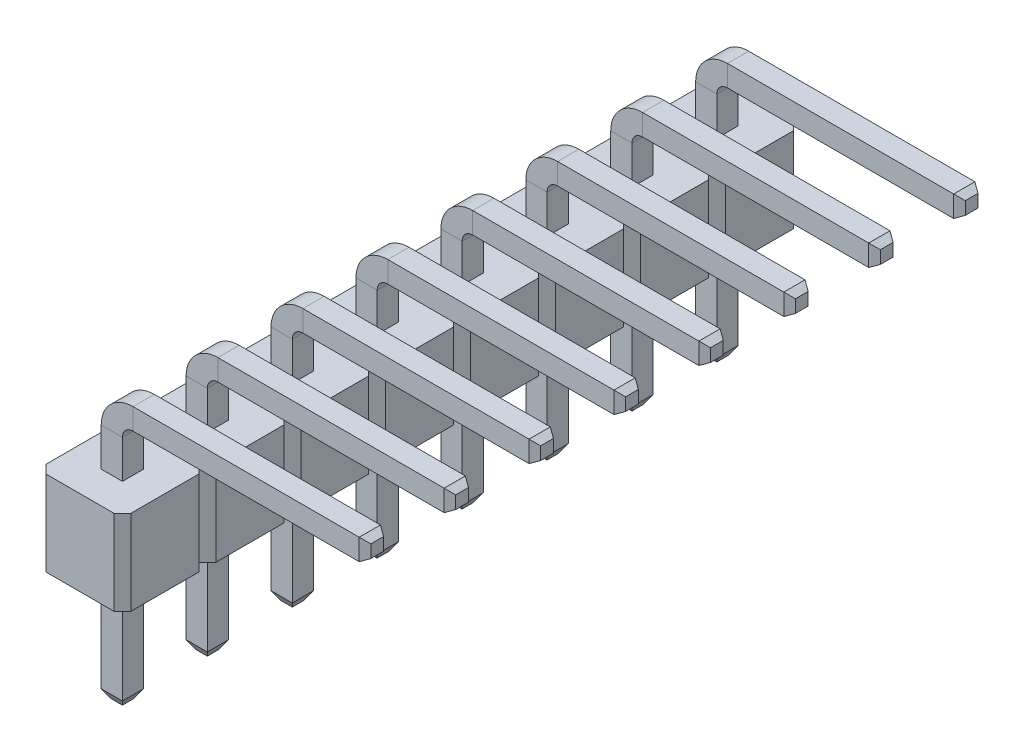
from build123d import *
from OCP.BRepFilletAPI import BRepFilletAPI_MakeChamfer

# Parameters (mm, degrees)
BOSS_EXTRUDE1_DEPTH          = 2.54
SKETCH3_W                    = 0.635
SKETCH3_H                    = 0.635
CHAMFER1_SIZE                = 0.254
CHAMFER1_SIZE2               = 0.146646968
CHAMFER2_SIZE                = 0.219970453
CHAMFER2_SIZE_2              = 0.127
LPATTERN1_COUNT              = 8
LPATTERN1_PITCH              = 2.54
CHAMFER1_OF_LPATTERN1_SIZE   = 0.254
CHAMFER1_OF_LPATTERN1_SIZE2  = 0.146646968
CHAMFER2_OF_LPATTERN1_SIZE   = 0.219970453
CHAMFER2_OF_LPATTERN1_SIZE_2 = 0.127


with BuildPart() as part:
    # Sketch1 → Boss-Extrude1 (new body)
    with BuildSketch(Plane(origin=(0, 0, 0), x_dir=(1, 0, 0), z_dir=(0, 1, 0))):
        Polygon((1.016, 1.27), (1.27, 1.016), (1.27, -1.016), (1.016, -1.27), (-1.016, -1.27), (-1.27, -1.016), (-1.27, 1.016), (-1.016, 1.27), align=None)
    boss_extrude1 = extrude(amount=BOSS_EXTRUDE1_DEPTH)

    # Sweep1: sweep along a path in Sketch2
    with BuildLine(Plane.XY) as sweep1_path:
        Line((0, -3.4036), (0, 0))
        Line((0, 0), (0, 3.683))
        ThreePointArc((0, 3.683), (0.185987194, 4.132012806), (0.635, 4.318))
        Line((0.635, 4.318), (7.62, 4.318))
    # Sketch3 → Sweep1 (sweep)
    with BuildSketch(Plane(origin=(0, -3.4036, 0), x_dir=(-1, 0, 0), z_dir=(0, -1, 0))):
        Rectangle(SKETCH3_W, SKETCH3_H)
    sweep1 = sweep(path=sweep1_path.line)

    # Chamfer1: one chamfer whose edges measure the first distance from different faces: ONE call of the kernel's chamfer builder (chamfer() names one face for all edges)
    chamfer1_edges_1 = [part.edges().sort_by_distance(p)[0] for p in [
        (0.3175, -3.4036, 0),
    ]]
    chamfer1_side_1 = [part.faces().sort_by_distance(p)[0] for p in [
        (0.3175, -1.7018, 0),
    ]]
    chamfer1_edges_2 = [part.edges().sort_by_distance(p)[0] for p in [
        (0, -3.4036, 0.3175),
    ]]
    chamfer1_side_2 = [part.faces().sort_by_distance(p)[0] for p in [
        (0, -1.7018, 0.3175),
    ]]
    chamfer1_edges_3 = [part.edges().sort_by_distance(p)[0] for p in [
        (-0.3175, -3.4036, 0),
    ]]
    chamfer1_side_3 = [part.faces().sort_by_distance(p)[0] for p in [
        (-0.3175, -1.7018, 0),
    ]]
    chamfer1_edges_4 = [part.edges().sort_by_distance(p)[0] for p in [
        (0, -3.4036, -0.3175),
    ]]
    chamfer1_side_4 = [part.faces().sort_by_distance(p)[0] for p in [
        (0, -1.7018, -0.3175),
    ]]
    chamfer1 = BRepFilletAPI_MakeChamfer(part.part.solid().wrapped)
    for e in chamfer1_edges_1:
        chamfer1.Add(CHAMFER1_SIZE, CHAMFER1_SIZE2, e.wrapped, chamfer1_side_1[0].wrapped)  # the first distance lies on this face
    for e in chamfer1_edges_2:
        chamfer1.Add(CHAMFER1_SIZE, CHAMFER1_SIZE2, e.wrapped, chamfer1_side_2[0].wrapped)  # the first distance lies on this face
    for e in chamfer1_edges_3:
        chamfer1.Add(CHAMFER1_SIZE, CHAMFER1_SIZE2, e.wrapped, chamfer1_side_3[0].wrapped)  # the first distance lies on this face
    for e in chamfer1_edges_4:
        chamfer1.Add(CHAMFER1_SIZE, CHAMFER1_SIZE2, e.wrapped, chamfer1_side_4[0].wrapped)  # the first distance lies on this face
    add(Compound.cast(chamfer1.Shape()), mode=Mode.REPLACE)

    # Chamfer2
    chamfer2_edges_1 = [part.edges().sort_by_distance(p)[0] for p in [
        (7.62, 4.0005, 0),
    ]]
    chamfer2_side_1 = [part.faces().sort_by_distance(p)[0] for p in [
        (7.61746, 4.0005, 0),
    ]]
    chamfer2_edges_2 = [part.edges().sort_by_distance(p)[0] for p in [
        (7.62, 4.318, 0.3175),
    ]]
    chamfer2_side_2 = [part.faces().sort_by_distance(p)[0] for p in [
        (7.61746, 4.318, 0.3175),
    ]]
    chamfer2_edges_3 = [part.edges().sort_by_distance(p)[0] for p in [
        (7.62, 4.6355, 0),
    ]]
    chamfer2_side_3 = [part.faces().sort_by_distance(p)[0] for p in [
        (7.62, 4.63296, 0),
    ]]
    chamfer2_edges_4 = [part.edges().sort_by_distance(p)[0] for p in [
        (7.62, 4.318, -0.3175),
    ]]
    chamfer2_side_4 = [part.faces().sort_by_distance(p)[0] for p in [
        (7.61746, 4.318, -0.3175),
    ]]
    chamfer2 = BRepFilletAPI_MakeChamfer(part.part.solid().wrapped)
    for e in chamfer2_edges_1:
        chamfer2.Add(CHAMFER2_SIZE - 0.0001, CHAMFER2_SIZE_2 - 0.0001, e.wrapped, chamfer2_side_1[0].wrapped)
    for e in chamfer2_edges_2:
        chamfer2.Add(CHAMFER2_SIZE - 0.0001, CHAMFER2_SIZE_2 - 0.0001, e.wrapped, chamfer2_side_2[0].wrapped)
    for e in chamfer2_edges_3:
        chamfer2.Add(CHAMFER2_SIZE_2 - 0.0001, CHAMFER2_SIZE - 0.0001, e.wrapped, chamfer2_side_3[0].wrapped)
    for e in chamfer2_edges_4:
        chamfer2.Add(CHAMFER2_SIZE - 0.0001, CHAMFER2_SIZE_2 - 0.0001, e.wrapped, chamfer2_side_4[0].wrapped)
    add(Compound.cast(chamfer2.Shape()), mode=Mode.REPLACE)  # a hair under: the kernel refuses the full size

    # LPattern1: Boss-Extrude1, Sweep1 ×8
    with Locations(*[(0, 0, i * LPATTERN1_PITCH) for i in range(1, LPATTERN1_COUNT)]):
        add(boss_extrude1)
        add(sweep1)

    # Chamfer1 of LPattern1: one chamfer whose edges measure the first distance from different faces: ONE call of the kernel's chamfer builder (chamfer() names one face for all edges)
    chamfer1_of_lpattern1_edges_1 = [part.edges().sort_by_distance(p)[0] for p in [
        (0.3175, -3.4036, 2.54),
    ]]
    chamfer1_of_lpattern1_side_1 = [part.faces().sort_by_distance(p)[0] for p in [
        (0.3175, -1.7018, 2.54),
    ]]
    chamfer1_of_lpattern1_edges_2 = [part.edges().sort_by_distance(p)[0] for p in [
        (0, -3.4036, 2.8575),
    ]]
    chamfer1_of_lpattern1_side_2 = [part.faces().sort_by_distance(p)[0] for p in [
        (0, -1.7018, 2.8575),
    ]]
    chamfer1_of_lpattern1_edges_3 = [part.edges().sort_by_distance(p)[0] for p in [
        (-0.3175, -3.4036, 2.54),
    ]]
    chamfer1_of_lpattern1_side_3 = [part.faces().sort_by_distance(p)[0] for p in [
        (-0.3175, -1.7018, 2.54),
    ]]
    chamfer1_of_lpattern1_edges_4 = [part.edges().sort_by_distance(p)[0] for p in [
        (0, -3.4036, 2.2225),
    ]]
    chamfer1_of_lpattern1_side_4 = [part.faces().sort_by_distance(p)[0] for p in [
        (0, -1.7018, 2.2225),
    ]]
    chamfer1_of_lpattern1_edges_5 = [part.edges().sort_by_distance(p)[0] for p in [
        (0.3175, -3.4036, 5.08),
    ]]
    chamfer1_of_lpattern1_side_5 = [part.faces().sort_by_distance(p)[0] for p in [
        (0.3175, -1.7018, 5.08),
    ]]
    chamfer1_of_lpattern1_edges_6 = [part.edges().sort_by_distance(p)[0] for p in [
        (0, -3.4036, 5.3975),
    ]]
    chamfer1_of_lpattern1_side_6 = [part.faces().sort_by_distance(p)[0] for p in [
        (0, -1.7018, 5.3975),
    ]]
    chamfer1_of_lpattern1_edges_7 = [part.edges().sort_by_distance(p)[0] for p in [
        (-0.3175, -3.4036, 5.08),
    ]]
    chamfer1_of_lpattern1_side_7 = [part.faces().sort_by_distance(p)[0] for p in [
        (-0.3175, -1.7018, 5.08),
    ]]
    chamfer1_of_lpattern1_edges_8 = [part.edges().sort_by_distance(p)[0] for p in [
        (0, -3.4036, 4.7625),
    ]]
    chamfer1_of_lpattern1_side_8 = [part.faces().sort_by_distance(p)[0] for p in [
        (0, -1.7018, 4.7625),
    ]]
    chamfer1_of_lpattern1_edges_9 = [part.edges().sort_by_distance(p)[0] for p in [
        (0.3175, -3.4036, 7.62),
    ]]
    chamfer1_of_lpattern1_side_9 = [part.faces().sort_by_distance(p)[0] for p in [
        (0.3175, -1.7018, 7.62),
    ]]
    chamfer1_of_lpattern1_edges_10 = [part.edges().sort_by_distance(p)[0] for p in [
        (0, -3.4036, 7.9375),
    ]]
    chamfer1_of_lpattern1_side_10 = [part.faces().sort_by_distance(p)[0] for p in [
        (0, -1.7018, 7.9375),
    ]]
    chamfer1_of_lpattern1_edges_11 = [part.edges().sort_by_distance(p)[0] for p in [
        (-0.3175, -3.4036, 7.62),
    ]]
    chamfer1_of_lpattern1_side_11 = [part.faces().sort_by_distance(p)[0] for p in [
        (-0.3175, -1.7018, 7.62),
    ]]
    chamfer1_of_lpattern1_edges_12 = [part.edges().sort_by_distance(p)[0] for p in [
        (0, -3.4036, 7.3025),
    ]]
    chamfer1_of_lpattern1_side_12 = [part.faces().sort_by_distance(p)[0] for p in [
        (0, -1.7018, 7.3025),
    ]]
    chamfer1_of_lpattern1_edges_13 = [part.edges().sort_by_distance(p)[0] for p in [
        (0.3175, -3.4036, 10.16),
    ]]
    chamfer1_of_lpattern1_side_13 = [part.faces().sort_by_distance(p)[0] for p in [
        (0.3175, -1.7018, 10.16),
    ]]
    chamfer1_of_lpattern1_edges_14 = [part.edges().sort_by_distance(p)[0] for p in [
        (0, -3.4036, 10.4775),
    ]]
    chamfer1_of_lpattern1_side_14 = [part.faces().sort_by_distance(p)[0] for p in [
        (0, -1.7018, 10.4775),
    ]]
    chamfer1_of_lpattern1_edges_15 = [part.edges().sort_by_distance(p)[0] for p in [
        (-0.3175, -3.4036, 10.16),
    ]]
    chamfer1_of_lpattern1_side_15 = [part.faces().sort_by_distance(p)[0] for p in [
        (-0.3175, -1.7018, 10.16),
    ]]
    chamfer1_of_lpattern1_edges_16 = [part.edges().sort_by_distance(p)[0] for p in [
        (0, -3.4036, 9.8425),
    ]]
    chamfer1_of_lpattern1_side_16 = [part.faces().sort_by_distance(p)[0] for p in [
        (0, -1.7018, 9.8425),
    ]]
    chamfer1_of_lpattern1_edges_17 = [part.edges().sort_by_distance(p)[0] for p in [
        (0.3175, -3.4036, 12.7),
    ]]
    chamfer1_of_lpattern1_side_17 = [part.faces().sort_by_distance(p)[0] for p in [
        (0.3175, -1.7018, 12.7),
    ]]
    chamfer1_of_lpattern1_edges_18 = [part.edges().sort_by_distance(p)[0] for p in [
        (0, -3.4036, 13.0175),
    ]]
    chamfer1_of_lpattern1_side_18 = [part.faces().sort_by_distance(p)[0] for p in [
        (0, -1.7018, 13.0175),
    ]]
    chamfer1_of_lpattern1_edges_19 = [part.edges().sort_by_distance(p)[0] for p in [
        (-0.3175, -3.4036, 12.7),
    ]]
    chamfer1_of_lpattern1_side_19 = [part.faces().sort_by_distance(p)[0] for p in [
        (-0.3175, -1.7018, 12.7),
    ]]
    chamfer1_of_lpattern1_edges_20 = [part.edges().sort_by_distance(p)[0] for p in [
        (0, -3.4036, 12.3825),
    ]]
    chamfer1_of_lpattern1_side_20 = [part.faces().sort_by_distance(p)[0] for p in [
        (0, -1.7018, 12.3825),
    ]]
    chamfer1_of_lpattern1_edges_21 = [part.edges().sort_by_distance(p)[0] for p in [
        (0.3175, -3.4036, 15.24),
    ]]
    chamfer1_of_lpattern1_side_21 = [part.faces().sort_by_distance(p)[0] for p in [
        (0.3175, -1.7018, 15.24),
    ]]
    chamfer1_of_lpattern1_edges_22 = [part.edges().sort_by_distance(p)[0] for p in [
        (0, -3.4036, 15.5575),
    ]]
    chamfer1_of_lpattern1_side_22 = [part.faces().sort_by_distance(p)[0] for p in [
        (0, -1.7018, 15.5575),
    ]]
    chamfer1_of_lpattern1_edges_23 = [part.edges().sort_by_distance(p)[0] for p in [
        (-0.3175, -3.4036, 15.24),
    ]]
    chamfer1_of_lpattern1_side_23 = [part.faces().sort_by_distance(p)[0] for p in [
        (-0.3175, -1.7018, 15.24),
    ]]
    chamfer1_of_lpattern1_edges_24 = [part.edges().sort_by_distance(p)[0] for p in [
        (0, -3.4036, 14.9225),
    ]]
    chamfer1_of_lpattern1_side_24 = [part.faces().sort_by_distance(p)[0] for p in [
        (0, -1.7018, 14.9225),
    ]]
    chamfer1_of_lpattern1_edges_25 = [part.edges().sort_by_distance(p)[0] for p in [
        (0.3175, -3.4036, 17.78),
    ]]
    chamfer1_of_lpattern1_side_25 = [part.faces().sort_by_distance(p)[0] for p in [
        (0.3175, -1.7018, 17.78),
    ]]
    chamfer1_of_lpattern1_edges_26 = [part.edges().sort_by_distance(p)[0] for p in [
        (0, -3.4036, 18.0975),
    ]]
    chamfer1_of_lpattern1_side_26 = [part.faces().sort_by_distance(p)[0] for p in [
        (0, -1.7018, 18.0975),
    ]]
    chamfer1_of_lpattern1_edges_27 = [part.edges().sort_by_distance(p)[0] for p in [
        (-0.3175, -3.4036, 17.78),
    ]]
    chamfer1_of_lpattern1_side_27 = [part.faces().sort_by_distance(p)[0] for p in [
        (-0.3175, -1.7018, 17.78),
    ]]
    chamfer1_of_lpattern1_edges_28 = [part.edges().sort_by_distance(p)[0] for p in [
        (0, -3.4036, 17.4625),
    ]]
    chamfer1_of_lpattern1_side_28 = [part.faces().sort_by_distance(p)[0] for p in [
        (0, -1.7018, 17.4625),
    ]]
    chamfer1_of_lpattern1 = BRepFilletAPI_MakeChamfer(part.part.solid().wrapped)
    for e in chamfer1_of_lpattern1_edges_1:
        chamfer1_of_lpattern1.Add(CHAMFER1_OF_LPATTERN1_SIZE, CHAMFER1_OF_LPATTERN1_SIZE2, e.wrapped, chamfer1_of_lpattern1_side_1[0].wrapped)  # the first distance lies on this face
    for e in chamfer1_of_lpattern1_edges_2:
        chamfer1_of_lpattern1.Add(CHAMFER1_OF_LPATTERN1_SIZE, CHAMFER1_OF_LPATTERN1_SIZE2, e.wrapped, chamfer1_of_lpattern1_side_2[0].wrapped)  # the first distance lies on this face
    for e in chamfer1_of_lpattern1_edges_3:
        chamfer1_of_lpattern1.Add(CHAMFER1_OF_LPATTERN1_SIZE, CHAMFER1_OF_LPATTERN1_SIZE2, e.wrapped, chamfer1_of_lpattern1_side_3[0].wrapped)  # the first distance lies on this face
    for e in chamfer1_of_lpattern1_edges_4:
        chamfer1_of_lpattern1.Add(CHAMFER1_OF_LPATTERN1_SIZE, CHAMFER1_OF_LPATTERN1_SIZE2, e.wrapped, chamfer1_of_lpattern1_side_4[0].wrapped)  # the first distance lies on this face
    for e in chamfer1_of_lpattern1_edges_5:
        chamfer1_of_lpattern1.Add(CHAMFER1_OF_LPATTERN1_SIZE, CHAMFER1_OF_LPATTERN1_SIZE2, e.wrapped, chamfer1_of_lpattern1_side_5[0].wrapped)  # the first distance lies on this face
    for e in chamfer1_of_lpattern1_edges_6:
        chamfer1_of_lpattern1.Add(CHAMFER1_OF_LPATTERN1_SIZE, CHAMFER1_OF_LPATTERN1_SIZE2, e.wrapped, chamfer1_of_lpattern1_side_6[0].wrapped)  # the first distance lies on this face
    for e in chamfer1_of_lpattern1_edges_7:
        chamfer1_of_lpattern1.Add(CHAMFER1_OF_LPATTERN1_SIZE, CHAMFER1_OF_LPATTERN1_SIZE2, e.wrapped, chamfer1_of_lpattern1_side_7[0].wrapped)  # the first distance lies on this face
    for e in chamfer1_of_lpattern1_edges_8:
        chamfer1_of_lpattern1.Add(CHAMFER1_OF_LPATTERN1_SIZE, CHAMFER1_OF_LPATTERN1_SIZE2, e.wrapped, chamfer1_of_lpattern1_side_8[0].wrapped)  # the first distance lies on this face
    for e in chamfer1_of_lpattern1_edges_9:
        chamfer1_of_lpattern1.Add(CHAMFER1_OF_LPATTERN1_SIZE, CHAMFER1_OF_LPATTERN1_SIZE2, e.wrapped, chamfer1_of_lpattern1_side_9[0].wrapped)  # the first distance lies on this face
    for e in chamfer1_of_lpattern1_edges_10:
        chamfer1_of_lpattern1.Add(CHAMFER1_OF_LPATTERN1_SIZE, CHAMFER1_OF_LPATTERN1_SIZE2, e.wrapped, chamfer1_of_lpattern1_side_10[0].wrapped)  # the first distance lies on this face
    for e in chamfer1_of_lpattern1_edges_11:
        chamfer1_of_lpattern1.Add(CHAMFER1_OF_LPATTERN1_SIZE, CHAMFER1_OF_LPATTERN1_SIZE2, e.wrapped, chamfer1_of_lpattern1_side_11[0].wrapped)  # the first distance lies on this face
    for e in chamfer1_of_lpattern1_edges_12:
        chamfer1_of_lpattern1.Add(CHAMFER1_OF_LPATTERN1_SIZE, CHAMFER1_OF_LPATTERN1_SIZE2, e.wrapped, chamfer1_of_lpattern1_side_12[0].wrapped)  # the first distance lies on this face
    for e in chamfer1_of_lpattern1_edges_13:
        chamfer1_of_lpattern1.Add(CHAMFER1_OF_LPATTERN1_SIZE, CHAMFER1_OF_LPATTERN1_SIZE2, e.wrapped, chamfer1_of_lpattern1_side_13[0].wrapped)  # the first distance lies on this face
    for e in chamfer1_of_lpattern1_edges_14:
        chamfer1_of_lpattern1.Add(CHAMFER1_OF_LPATTERN1_SIZE, CHAMFER1_OF_LPATTERN1_SIZE2, e.wrapped, chamfer1_of_lpattern1_side_14[0].wrapped)  # the first distance lies on this face
    for e in chamfer1_of_lpattern1_edges_15:
        chamfer1_of_lpattern1.Add(CHAMFER1_OF_LPATTERN1_SIZE, CHAMFER1_OF_LPATTERN1_SIZE2, e.wrapped, chamfer1_of_lpattern1_side_15[0].wrapped)  # the first distance lies on this face
    for e in chamfer1_of_lpattern1_edges_16:
        chamfer1_of_lpattern1.Add(CHAMFER1_OF_LPATTERN1_SIZE, CHAMFER1_OF_LPATTERN1_SIZE2, e.wrapped, chamfer1_of_lpattern1_side_16[0].wrapped)  # the first distance lies on this face
    for e in chamfer1_of_lpattern1_edges_17:
        chamfer1_of_lpattern1.Add(CHAMFER1_OF_LPATTERN1_SIZE, CHAMFER1_OF_LPATTERN1_SIZE2, e.wrapped, chamfer1_of_lpattern1_side_17[0].wrapped)  # the first distance lies on this face
    for e in chamfer1_of_lpattern1_edges_18:
        chamfer1_of_lpattern1.Add(CHAMFER1_OF_LPATTERN1_SIZE, CHAMFER1_OF_LPATTERN1_SIZE2, e.wrapped, chamfer1_of_lpattern1_side_18[0].wrapped)  # the first distance lies on this face
    for e in chamfer1_of_lpattern1_edges_19:
        chamfer1_of_lpattern1.Add(CHAMFER1_OF_LPATTERN1_SIZE, CHAMFER1_OF_LPATTERN1_SIZE2, e.wrapped, chamfer1_of_lpattern1_side_19[0].wrapped)  # the first distance lies on this face
    for e in chamfer1_of_lpattern1_edges_20:
        chamfer1_of_lpattern1.Add(CHAMFER1_OF_LPATTERN1_SIZE, CHAMFER1_OF_LPATTERN1_SIZE2, e.wrapped, chamfer1_of_lpattern1_side_20[0].wrapped)  # the first distance lies on this face
    for e in chamfer1_of_lpattern1_edges_21:
        chamfer1_of_lpattern1.Add(CHAMFER1_OF_LPATTERN1_SIZE, CHAMFER1_OF_LPATTERN1_SIZE2, e.wrapped, chamfer1_of_lpattern1_side_21[0].wrapped)  # the first distance lies on this face
    for e in chamfer1_of_lpattern1_edges_22:
        chamfer1_of_lpattern1.Add(CHAMFER1_OF_LPATTERN1_SIZE, CHAMFER1_OF_LPATTERN1_SIZE2, e.wrapped, chamfer1_of_lpattern1_side_22[0].wrapped)  # the first distance lies on this face
    for e in chamfer1_of_lpattern1_edges_23:
        chamfer1_of_lpattern1.Add(CHAMFER1_OF_LPATTERN1_SIZE, CHAMFER1_OF_LPATTERN1_SIZE2, e.wrapped, chamfer1_of_lpattern1_side_23[0].wrapped)  # the first distance lies on this face
    for e in chamfer1_of_lpattern1_edges_24:
        chamfer1_of_lpattern1.Add(CHAMFER1_OF_LPATTERN1_SIZE, CHAMFER1_OF_LPATTERN1_SIZE2, e.wrapped, chamfer1_of_lpattern1_side_24[0].wrapped)  # the first distance lies on this face
    for e in chamfer1_of_lpattern1_edges_25:
        chamfer1_of_lpattern1.Add(CHAMFER1_OF_LPATTERN1_SIZE, CHAMFER1_OF_LPATTERN1_SIZE2, e.wrapped, chamfer1_of_lpattern1_side_25[0].wrapped)  # the first distance lies on this face
    for e in chamfer1_of_lpattern1_edges_26:
        chamfer1_of_lpattern1.Add(CHAMFER1_OF_LPATTERN1_SIZE, CHAMFER1_OF_LPATTERN1_SIZE2, e.wrapped, chamfer1_of_lpattern1_side_26[0].wrapped)  # the first distance lies on this face
    for e in chamfer1_of_lpattern1_edges_27:
        chamfer1_of_lpattern1.Add(CHAMFER1_OF_LPATTERN1_SIZE, CHAMFER1_OF_LPATTERN1_SIZE2, e.wrapped, chamfer1_of_lpattern1_side_27[0].wrapped)  # the first distance lies on this face
    for e in chamfer1_of_lpattern1_edges_28:
        chamfer1_of_lpattern1.Add(CHAMFER1_OF_LPATTERN1_SIZE, CHAMFER1_OF_LPATTERN1_SIZE2, e.wrapped, chamfer1_of_lpattern1_side_28[0].wrapped)  # the first distance lies on this face
    add(Compound.cast(chamfer1_of_lpattern1.Shape()), mode=Mode.REPLACE)

    # Chamfer2 of LPattern1
    chamfer2_of_lpattern1_edges_1 = [part.edges().sort_by_distance(p)[0] for p in [
        (7.62, 4.0005, 2.54),
    ]]
    chamfer2_of_lpattern1_side_1 = [part.faces().sort_by_distance(p)[0] for p in [
        (7.61746, 4.0005, 2.54),
    ]]
    chamfer2_of_lpattern1_edges_2 = [part.edges().sort_by_distance(p)[0] for p in [
        (7.62, 4.318, 2.8575),
    ]]
    chamfer2_of_lpattern1_side_2 = [part.faces().sort_by_distance(p)[0] for p in [
        (7.61746, 4.318, 2.8575),
    ]]
    chamfer2_of_lpattern1_edges_3 = [part.edges().sort_by_distance(p)[0] for p in [
        (7.62, 4.6355, 2.54),
    ]]
    chamfer2_of_lpattern1_side_3 = [part.faces().sort_by_distance(p)[0] for p in [
        (7.62, 4.63296, 2.54),
    ]]
    chamfer2_of_lpattern1_edges_4 = [part.edges().sort_by_distance(p)[0] for p in [
        (7.62, 4.318, 2.2225),
    ]]
    chamfer2_of_lpattern1_side_4 = [part.faces().sort_by_distance(p)[0] for p in [
        (7.61746, 4.318, 2.2225),
    ]]
    chamfer2_of_lpattern1_edges_5 = [part.edges().sort_by_distance(p)[0] for p in [
        (7.62, 4.0005, 5.08),
    ]]
    chamfer2_of_lpattern1_side_5 = [part.faces().sort_by_distance(p)[0] for p in [
        (7.61746, 4.0005, 5.08),
    ]]
    chamfer2_of_lpattern1_edges_6 = [part.edges().sort_by_distance(p)[0] for p in [
        (7.62, 4.318, 5.3975),
    ]]
    chamfer2_of_lpattern1_side_6 = [part.faces().sort_by_distance(p)[0] for p in [
        (7.61746, 4.318, 5.3975),
    ]]
    chamfer2_of_lpattern1_edges_7 = [part.edges().sort_by_distance(p)[0] for p in [
        (7.62, 4.6355, 5.08),
    ]]
    chamfer2_of_lpattern1_side_7 = [part.faces().sort_by_distance(p)[0] for p in [
        (7.62, 4.63296, 5.08),
    ]]
    chamfer2_of_lpattern1_edges_8 = [part.edges().sort_by_distance(p)[0] for p in [
        (7.62, 4.318, 4.7625),
    ]]
    chamfer2_of_lpattern1_side_8 = [part.faces().sort_by_distance(p)[0] for p in [
        (7.61746, 4.318, 4.7625),
    ]]
    chamfer2_of_lpattern1_edges_9 = [part.edges().sort_by_distance(p)[0] for p in [
        (7.62, 4.0005, 7.62),
    ]]
    chamfer2_of_lpattern1_side_9 = [part.faces().sort_by_distance(p)[0] for p in [
        (7.61746, 4.0005, 7.62),
    ]]
    chamfer2_of_lpattern1_edges_10 = [part.edges().sort_by_distance(p)[0] for p in [
        (7.62, 4.318, 7.9375),
    ]]
    chamfer2_of_lpattern1_side_10 = [part.faces().sort_by_distance(p)[0] for p in [
        (7.61746, 4.318, 7.9375),
    ]]
    chamfer2_of_lpattern1_edges_11 = [part.edges().sort_by_distance(p)[0] for p in [
        (7.62, 4.6355, 7.62),
    ]]
    chamfer2_of_lpattern1_side_11 = [part.faces().sort_by_distance(p)[0] for p in [
        (7.62, 4.63296, 7.62),
    ]]
    chamfer2_of_lpattern1_edges_12 = [part.edges().sort_by_distance(p)[0] for p in [
        (7.62, 4.318, 7.3025),
    ]]
    chamfer2_of_lpattern1_side_12 = [part.faces().sort_by_distance(p)[0] for p in [
        (7.61746, 4.318, 7.3025),
    ]]
    chamfer2_of_lpattern1_edges_13 = [part.edges().sort_by_distance(p)[0] for p in [
        (7.62, 4.0005, 10.16),
    ]]
    chamfer2_of_lpattern1_side_13 = [part.faces().sort_by_distance(p)[0] for p in [
        (7.61746, 4.0005, 10.16),
    ]]
    chamfer2_of_lpattern1_edges_14 = [part.edges().sort_by_distance(p)[0] for p in [
        (7.62, 4.318, 10.4775),
    ]]
    chamfer2_of_lpattern1_side_14 = [part.faces().sort_by_distance(p)[0] for p in [
        (7.61746, 4.318, 10.4775),
    ]]
    chamfer2_of_lpattern1_edges_15 = [part.edges().sort_by_distance(p)[0] for p in [
        (7.62, 4.6355, 10.16),
    ]]
    chamfer2_of_lpattern1_side_15 = [part.faces().sort_by_distance(p)[0] for p in [
        (7.62, 4.63296, 10.16),
    ]]
    chamfer2_of_lpattern1_edges_16 = [part.edges().sort_by_distance(p)[0] for p in [
        (7.62, 4.318, 9.8425),
    ]]
    chamfer2_of_lpattern1_side_16 = [part.faces().sort_by_distance(p)[0] for p in [
        (7.61746, 4.318, 9.8425),
    ]]
    chamfer2_of_lpattern1_edges_17 = [part.edges().sort_by_distance(p)[0] for p in [
        (7.62, 4.0005, 12.7),
    ]]
    chamfer2_of_lpattern1_side_17 = [part.faces().sort_by_distance(p)[0] for p in [
        (7.61746, 4.0005, 12.7),
    ]]
    chamfer2_of_lpattern1_edges_18 = [part.edges().sort_by_distance(p)[0] for p in [
        (7.62, 4.318, 13.0175),
    ]]
    chamfer2_of_lpattern1_side_18 = [part.faces().sort_by_distance(p)[0] for p in [
        (7.61746, 4.318, 13.0175),
    ]]
    chamfer2_of_lpattern1_edges_19 = [part.edges().sort_by_distance(p)[0] for p in [
        (7.62, 4.6355, 12.7),
    ]]
    chamfer2_of_lpattern1_side_19 = [part.faces().sort_by_distance(p)[0] for p in [
        (7.62, 4.63296, 12.7),
    ]]
    chamfer2_of_lpattern1_edges_20 = [part.edges().sort_by_distance(p)[0] for p in [
        (7.62, 4.318, 12.3825),
    ]]
    chamfer2_of_lpattern1_side_20 = [part.faces().sort_by_distance(p)[0] for p in [
        (7.61746, 4.318, 12.3825),
    ]]
    chamfer2_of_lpattern1_edges_21 = [part.edges().sort_by_distance(p)[0] for p in [
        (7.62, 4.0005, 15.24),
    ]]
    chamfer2_of_lpattern1_side_21 = [part.faces().sort_by_distance(p)[0] for p in [
        (7.61746, 4.0005, 15.24),
    ]]
    chamfer2_of_lpattern1_edges_22 = [part.edges().sort_by_distance(p)[0] for p in [
        (7.62, 4.318, 15.5575),
    ]]
    chamfer2_of_lpattern1_side_22 = [part.faces().sort_by_distance(p)[0] for p in [
        (7.61746, 4.318, 15.5575),
    ]]
    chamfer2_of_lpattern1_edges_23 = [part.edges().sort_by_distance(p)[0] for p in [
        (7.62, 4.6355, 15.24),
    ]]
    chamfer2_of_lpattern1_side_23 = [part.faces().sort_by_distance(p)[0] for p in [
        (7.62, 4.63296, 15.24),
    ]]
    chamfer2_of_lpattern1_edges_24 = [part.edges().sort_by_distance(p)[0] for p in [
        (7.62, 4.318, 14.9225),
    ]]
    chamfer2_of_lpattern1_side_24 = [part.faces().sort_by_distance(p)[0] for p in [
        (7.61746, 4.318, 14.9225),
    ]]
    chamfer2_of_lpattern1_edges_25 = [part.edges().sort_by_distance(p)[0] for p in [
        (7.62, 4.0005, 17.78),
    ]]
    chamfer2_of_lpattern1_side_25 = [part.faces().sort_by_distance(p)[0] for p in [
        (7.61746, 4.0005, 17.78),
    ]]
    chamfer2_of_lpattern1_edges_26 = [part.edges().sort_by_distance(p)[0] for p in [
        (7.62, 4.318, 18.0975),
    ]]
    chamfer2_of_lpattern1_side_26 = [part.faces().sort_by_distance(p)[0] for p in [
        (7.61746, 4.318, 18.0975),
    ]]
    chamfer2_of_lpattern1_edges_27 = [part.edges().sort_by_distance(p)[0] for p in [
        (7.62, 4.6355, 17.78),
    ]]
    chamfer2_of_lpattern1_side_27 = [part.faces().sort_by_distance(p)[0] for p in [
        (7.62, 4.63296, 17.78),
    ]]
    chamfer2_of_lpattern1_edges_28 = [part.edges().sort_by_distance(p)[0] for p in [
        (7.62, 4.318, 17.4625),
    ]]
    chamfer2_of_lpattern1_side_28 = [part.faces().sort_by_distance(p)[0] for p in [
        (7.61746, 4.318, 17.4625),
    ]]
    chamfer2_of_lpattern1 = BRepFilletAPI_MakeChamfer(part.part.solid().wrapped)
    for e in chamfer2_of_lpattern1_edges_1:
        chamfer2_of_lpattern1.Add(CHAMFER2_OF_LPATTERN1_SIZE - 0.0001, CHAMFER2_OF_LPATTERN1_SIZE_2 - 0.0001, e.wrapped, chamfer2_of_lpattern1_side_1[0].wrapped)
    for e in chamfer2_of_lpattern1_edges_2:
        chamfer2_of_lpattern1.Add(CHAMFER2_OF_LPATTERN1_SIZE - 0.0001, CHAMFER2_OF_LPATTERN1_SIZE_2 - 0.0001, e.wrapped, chamfer2_of_lpattern1_side_2[0].wrapped)
    for e in chamfer2_of_lpattern1_edges_3:
        chamfer2_of_lpattern1.Add(CHAMFER2_OF_LPATTERN1_SIZE_2 - 0.0001, CHAMFER2_OF_LPATTERN1_SIZE - 0.0001, e.wrapped, chamfer2_of_lpattern1_side_3[0].wrapped)
    for e in chamfer2_of_lpattern1_edges_4:
        chamfer2_of_lpattern1.Add(CHAMFER2_OF_LPATTERN1_SIZE - 0.0001, CHAMFER2_OF_LPATTERN1_SIZE_2 - 0.0001, e.wrapped, chamfer2_of_lpattern1_side_4[0].wrapped)
    for e in chamfer2_of_lpattern1_edges_5:
        chamfer2_of_lpattern1.Add(CHAMFER2_OF_LPATTERN1_SIZE - 0.0001, CHAMFER2_OF_LPATTERN1_SIZE_2 - 0.0001, e.wrapped, chamfer2_of_lpattern1_side_5[0].wrapped)
    for e in chamfer2_of_lpattern1_edges_6:
        chamfer2_of_lpattern1.Add(CHAMFER2_OF_LPATTERN1_SIZE - 0.0001, CHAMFER2_OF_LPATTERN1_SIZE_2 - 0.0001, e.wrapped, chamfer2_of_lpattern1_side_6[0].wrapped)
    for e in chamfer2_of_lpattern1_edges_7:
        chamfer2_of_lpattern1.Add(CHAMFER2_OF_LPATTERN1_SIZE_2 - 0.0001, CHAMFER2_OF_LPATTERN1_SIZE - 0.0001, e.wrapped, chamfer2_of_lpattern1_side_7[0].wrapped)
    for e in chamfer2_of_lpattern1_edges_8:
        chamfer2_of_lpattern1.Add(CHAMFER2_OF_LPATTERN1_SIZE - 0.0001, CHAMFER2_OF_LPATTERN1_SIZE_2 - 0.0001, e.wrapped, chamfer2_of_lpattern1_side_8[0].wrapped)
    for e in chamfer2_of_lpattern1_edges_9:
        chamfer2_of_lpattern1.Add(CHAMFER2_OF_LPATTERN1_SIZE - 0.0001, CHAMFER2_OF_LPATTERN1_SIZE_2 - 0.0001, e.wrapped, chamfer2_of_lpattern1_side_9[0].wrapped)
    for e in chamfer2_of_lpattern1_edges_10:
        chamfer2_of_lpattern1.Add(CHAMFER2_OF_LPATTERN1_SIZE - 0.0001, CHAMFER2_OF_LPATTERN1_SIZE_2 - 0.0001, e.wrapped, chamfer2_of_lpattern1_side_10[0].wrapped)
    for e in chamfer2_of_lpattern1_edges_11:
        chamfer2_of_lpattern1.Add(CHAMFER2_OF_LPATTERN1_SIZE_2 - 0.0001, CHAMFER2_OF_LPATTERN1_SIZE - 0.0001, e.wrapped, chamfer2_of_lpattern1_side_11[0].wrapped)
    for e in chamfer2_of_lpattern1_edges_12:
        chamfer2_of_lpattern1.Add(CHAMFER2_OF_LPATTERN1_SIZE - 0.0001, CHAMFER2_OF_LPATTERN1_SIZE_2 - 0.0001, e.wrapped, chamfer2_of_lpattern1_side_12[0].wrapped)
    for e in chamfer2_of_lpattern1_edges_13:
        chamfer2_of_lpattern1.Add(CHAMFER2_OF_LPATTERN1_SIZE - 0.0001, CHAMFER2_OF_LPATTERN1_SIZE_2 - 0.0001, e.wrapped, chamfer2_of_lpattern1_side_13[0].wrapped)
    for e in chamfer2_of_lpattern1_edges_14:
        chamfer2_of_lpattern1.Add(CHAMFER2_OF_LPATTERN1_SIZE - 0.0001, CHAMFER2_OF_LPATTERN1_SIZE_2 - 0.0001, e.wrapped, chamfer2_of_lpattern1_side_14[0].wrapped)
    for e in chamfer2_of_lpattern1_edges_15:
        chamfer2_of_lpattern1.Add(CHAMFER2_OF_LPATTERN1_SIZE_2 - 0.0001, CHAMFER2_OF_LPATTERN1_SIZE - 0.0001, e.wrapped, chamfer2_of_lpattern1_side_15[0].wrapped)
    for e in chamfer2_of_lpattern1_edges_16:
        chamfer2_of_lpattern1.Add(CHAMFER2_OF_LPATTERN1_SIZE - 0.0001, CHAMFER2_OF_LPATTERN1_SIZE_2 - 0.0001, e.wrapped, chamfer2_of_lpattern1_side_16[0].wrapped)
    for e in chamfer2_of_lpattern1_edges_17:
        chamfer2_of_lpattern1.Add(CHAMFER2_OF_LPATTERN1_SIZE - 0.0001, CHAMFER2_OF_LPATTERN1_SIZE_2 - 0.0001, e.wrapped, chamfer2_of_lpattern1_side_17[0].wrapped)
    for e in chamfer2_of_lpattern1_edges_18:
        chamfer2_of_lpattern1.Add(CHAMFER2_OF_LPATTERN1_SIZE - 0.0001, CHAMFER2_OF_LPATTERN1_SIZE_2 - 0.0001, e.wrapped, chamfer2_of_lpattern1_side_18[0].wrapped)
    for e in chamfer2_of_lpattern1_edges_19:
        chamfer2_of_lpattern1.Add(CHAMFER2_OF_LPATTERN1_SIZE_2 - 0.0001, CHAMFER2_OF_LPATTERN1_SIZE - 0.0001, e.wrapped, chamfer2_of_lpattern1_side_19[0].wrapped)
    for e in chamfer2_of_lpattern1_edges_20:
        chamfer2_of_lpattern1.Add(CHAMFER2_OF_LPATTERN1_SIZE - 0.0001, CHAMFER2_OF_LPATTERN1_SIZE_2 - 0.0001, e.wrapped, chamfer2_of_lpattern1_side_20[0].wrapped)
    for e in chamfer2_of_lpattern1_edges_21:
        chamfer2_of_lpattern1.Add(CHAMFER2_OF_LPATTERN1_SIZE - 0.0001, CHAMFER2_OF_LPATTERN1_SIZE_2 - 0.0001, e.wrapped, chamfer2_of_lpattern1_side_21[0].wrapped)
    for e in chamfer2_of_lpattern1_edges_22:
        chamfer2_of_lpattern1.Add(CHAMFER2_OF_LPATTERN1_SIZE - 0.0001, CHAMFER2_OF_LPATTERN1_SIZE_2 - 0.0001, e.wrapped, chamfer2_of_lpattern1_side_22[0].wrapped)
    for e in chamfer2_of_lpattern1_edges_23:
        chamfer2_of_lpattern1.Add(CHAMFER2_OF_LPATTERN1_SIZE_2 - 0.0001, CHAMFER2_OF_LPATTERN1_SIZE - 0.0001, e.wrapped, chamfer2_of_lpattern1_side_23[0].wrapped)
    for e in chamfer2_of_lpattern1_edges_24:
        chamfer2_of_lpattern1.Add(CHAMFER2_OF_LPATTERN1_SIZE - 0.0001, CHAMFER2_OF_LPATTERN1_SIZE_2 - 0.0001, e.wrapped, chamfer2_of_lpattern1_side_24[0].wrapped)
    for e in chamfer2_of_lpattern1_edges_25:
        chamfer2_of_lpattern1.Add(CHAMFER2_OF_LPATTERN1_SIZE - 0.0001, CHAMFER2_OF_LPATTERN1_SIZE_2 - 0.0001, e.wrapped, chamfer2_of_lpattern1_side_25[0].wrapped)
    for e in chamfer2_of_lpattern1_edges_26:
        chamfer2_of_lpattern1.Add(CHAMFER2_OF_LPATTERN1_SIZE - 0.0001, CHAMFER2_OF_LPATTERN1_SIZE_2 - 0.0001, e.wrapped, chamfer2_of_lpattern1_side_26[0].wrapped)
    for e in chamfer2_of_lpattern1_edges_27:
        chamfer2_of_lpattern1.Add(CHAMFER2_OF_LPATTERN1_SIZE_2 - 0.0001, CHAMFER2_OF_LPATTERN1_SIZE - 0.0001, e.wrapped, chamfer2_of_lpattern1_side_27[0].wrapped)
    for e in chamfer2_of_lpattern1_edges_28:
        chamfer2_of_lpattern1.Add(CHAMFER2_OF_LPATTERN1_SIZE - 0.0001, CHAMFER2_OF_LPATTERN1_SIZE_2 - 0.0001, e.wrapped, chamfer2_of_lpattern1_side_28[0].wrapped)
    add(Compound.cast(chamfer2_of_lpattern1.Shape()), mode=Mode.REPLACE)  # a hair under: the kernel refuses the full size


solid = part.part
